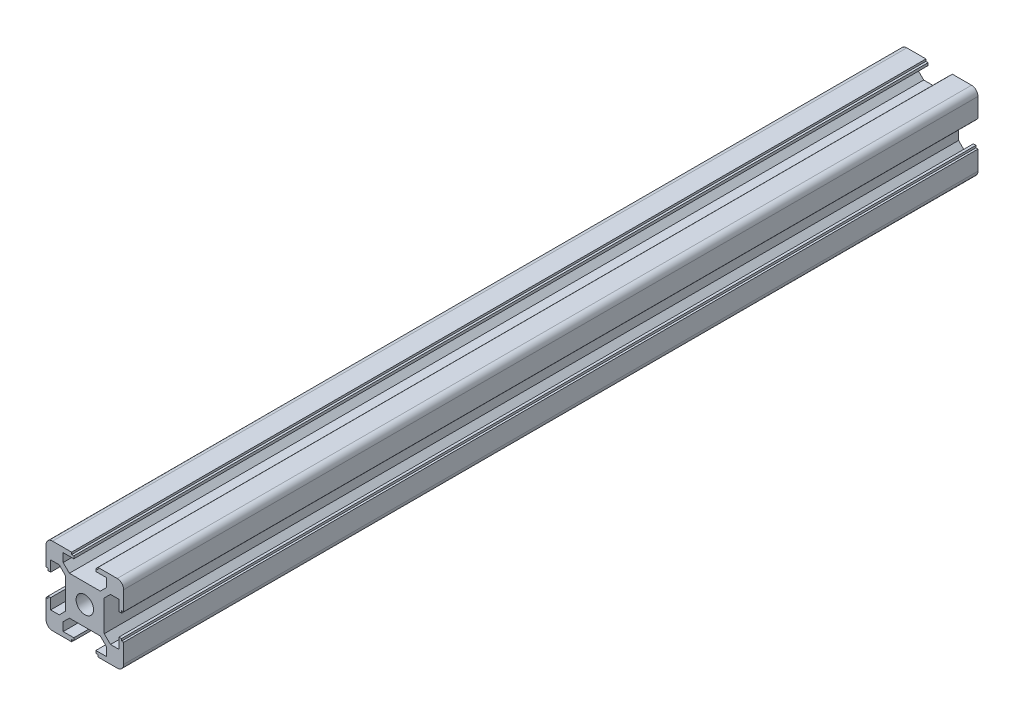
from build123d import *

# Parameters (mm, degrees)
SKETCH1_W                = 30
SKETCH1_H                = 30
BOSS_EXTRUDE1_DEPTH      = 165
SKETCH2_R                = 3.375
CUT_EXTRUDE1_DEPTH       = 331.681115276
FILLET1_R                = 2.5
CUT_EXTRUDE2_DEPTH       = 331.681115276
CIRPATTERN1_COPY_1_DEPTH = 331.681115276
CIRPATTERN1_COPY_2_DEPTH = 331.681115276
CIRPATTERN1_COPY_3_DEPTH = 331.681115276
CIRPATTERN1_COPY_4_DEPTH = 331.681115276
CIRPATTERN1_COPY_5_DEPTH = 331.681115276
CIRPATTERN1_COPY_6_DEPTH = 331.681115276


with BuildPart() as part:
    # Sketch1 → Boss-Extrude1 (new, symmetric)
    with BuildSketch(Plane.XY):
        Rectangle(SKETCH1_W, SKETCH1_H)
    extrude(amount=BOSS_EXTRUDE1_DEPTH, both=True)

    # Sketch2 → Cut-Extrude1 (cut, through all)
    with BuildSketch(Plane.XY.offset(165)):
        Circle(SKETCH2_R)
    extrude(amount=-CUT_EXTRUDE1_DEPTH, mode=Mode.SUBTRACT)

    # Fillet1
    fillet1_edges = [part.edges().sort_by_distance(p)[0] for p in [
        (15, -15, 0),
        (-15, -15, 0),
        (15, 15, 0),
        (-15, 15, 0),
    ]]
    fillet(fillet1_edges, radius=FILLET1_R)

    # Sketch3 → Cut-Extrude2 (cut, through all)
    with BuildSketch(Plane.XY.offset(165)):
        Polygon((0, 15), (-5.1, 15), (-5.1, 14.2), (-4.25, 14.2), (-4.25, 13.2), (-8.375, 13.2), (-8.375, 9.9), (-5.975, 7.5), (0, 7.5), align=None)
    cut_extrude2 = extrude(amount=-CUT_EXTRUDE2_DEPTH, mode=Mode.SUBTRACT)

    # Mirror1: Cut-Extrude2 across plane
    add(cut_extrude2.mirror(Plane(origin=(0, 0, 0), x_dir=(0, 0, 1), z_dir=(1, 0, 0))), mode=Mode.SUBTRACT)

    # CirPattern1 copy 1 sketch → CirPattern1 copy 1 (cut, through all)
    with BuildSketch(Plane(origin=(0, 0, 165), x_dir=(0, -1, 0), z_dir=(0, 0, 1))):
        Polygon((0, -15), (-5.1, -15), (-5.1, -14.2), (-4.25, -14.2), (-4.25, -13.2), (-8.375, -13.2), (-8.375, -9.9), (-5.975, -7.5), (0, -7.5), align=None)
    extrude(amount=-CIRPATTERN1_COPY_1_DEPTH, mode=Mode.SUBTRACT)

    # CirPattern1 copy 2 sketch → CirPattern1 copy 2 (cut, through all)
    with BuildSketch(Plane.XY.offset(165)):
        Polygon((0, -15), (-5.1, -15), (-5.1, -14.2), (-4.25, -14.2), (-4.25, -13.2), (-8.375, -13.2), (-8.375, -9.9), (-5.975, -7.5), (0, -7.5), align=None)
    extrude(amount=-CIRPATTERN1_COPY_2_DEPTH, mode=Mode.SUBTRACT)

    # CirPattern1 copy 3 sketch → CirPattern1 copy 3 (cut, through all)
    with BuildSketch(Plane(origin=(0, 0, 165), x_dir=(0, 1, 0), z_dir=(0, 0, 1))):
        Polygon((0, -15), (-5.1, -15), (-5.1, -14.2), (-4.25, -14.2), (-4.25, -13.2), (-8.375, -13.2), (-8.375, -9.9), (-5.975, -7.5), (0, -7.5), align=None)
    extrude(amount=-CIRPATTERN1_COPY_3_DEPTH, mode=Mode.SUBTRACT)

    # CirPattern1 copy 4 sketch → CirPattern1 copy 4 (cut, through all)
    with BuildSketch(Plane(origin=(0, 0, 165), x_dir=(0, 1, 0), z_dir=(0, 0, 1))):
        Polygon((0, 15), (-5.1, 15), (-5.1, 14.2), (-4.25, 14.2), (-4.25, 13.2), (-8.375, 13.2), (-8.375, 9.9), (-5.975, 7.5), (0, 7.5), align=None)
    extrude(amount=-CIRPATTERN1_COPY_4_DEPTH, mode=Mode.SUBTRACT)

    # CirPattern1 copy 5 sketch → CirPattern1 copy 5 (cut, through all)
    with BuildSketch(Plane(origin=(0, 0, 165), x_dir=(-1, 0, 0), z_dir=(0, 0, 1))):
        Polygon((0, 15), (-5.1, 15), (-5.1, 14.2), (-4.25, 14.2), (-4.25, 13.2), (-8.375, 13.2), (-8.375, 9.9), (-5.975, 7.5), (0, 7.5), align=None)
    extrude(amount=-CIRPATTERN1_COPY_5_DEPTH, mode=Mode.SUBTRACT)

    # CirPattern1 copy 6 sketch → CirPattern1 copy 6 (cut, through all)
    with BuildSketch(Plane(origin=(0, 0, 165), x_dir=(0, -1, 0), z_dir=(0, 0, 1))):
        Polygon((0, 15), (-5.1, 15), (-5.1, 14.2), (-4.25, 14.2), (-4.25, 13.2), (-8.375, 13.2), (-8.375, 9.9), (-5.975, 7.5), (0, 7.5), align=None)
    extrude(amount=-CIRPATTERN1_COPY_6_DEPTH, mode=Mode.SUBTRACT)


solid = part.part
